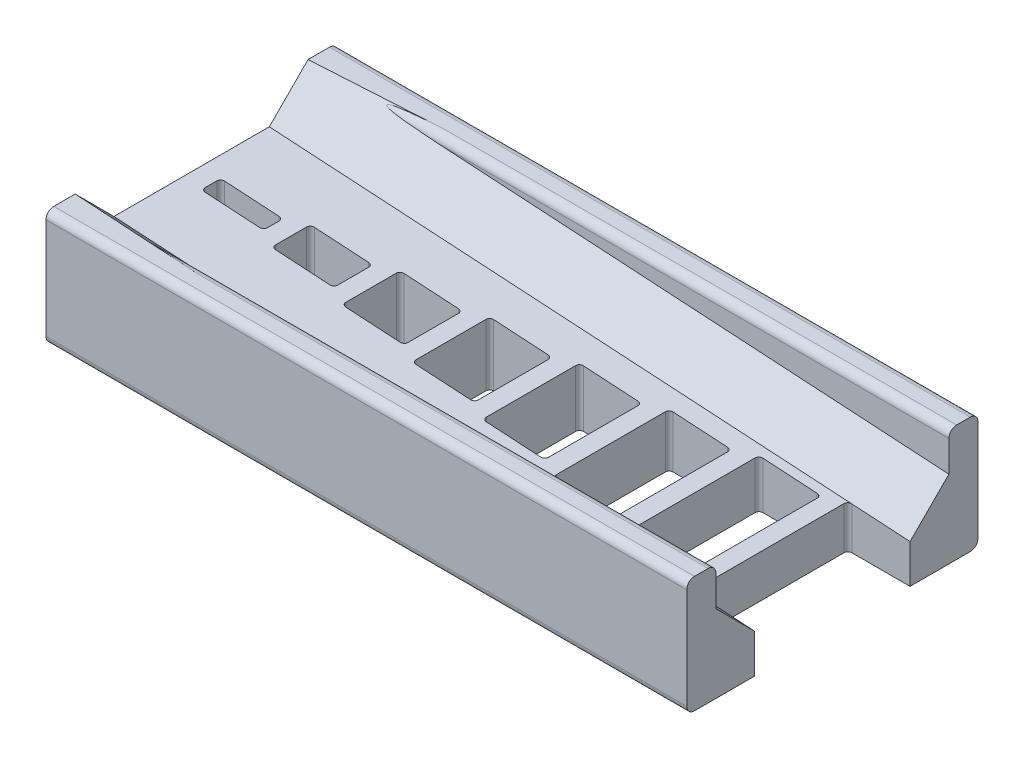
from build123d import *

# Parameters (mm, degrees)
BOSS_EXTRUDE1_DEPTH = 38.1
SKETCH2_W           = 209.55
SKETCH2_H           = 38.1
BOSS_EXTRUDE2_DEPTH = 9.525
SKETCH3_W           = 20.32
SKETCH3_H           = 6.35
SKETCH3_H_2         = 12.7
SKETCH3_H_3         = 19.05
SKETCH3_H_4         = 25.4
SKETCH3_H_5         = 31.75
SKETCH3_H_6         = 38.1
SKETCH3_H_7         = 44.45
SKETCH3_H_8         = 50.8
CUT_EXTRUDE1_DEPTH  = 123.141181515
FILLET1_R           = 1.27
CHAMFER1_SIZE       = 12.7
FILLET2_R           = 2.54


with BuildPart() as part:
    # Sketch1 → Boss-Extrude1 (new, symmetric)
    with BuildSketch(Plane.XY):
        Polygon((-105.823993484, 0), (103.726006516, 0), (103.726006516, 12.7), (-105.823993484, 25.4), align=None)
    extrude(amount=BOSS_EXTRUDE1_DEPTH, both=True)

    # Sketch2 → Boss-Extrude2 (add)
    with BuildSketch(Plane(origin=(0, 0, -38.1), x_dir=(-1, 0, 0), z_dir=(0, 0, -1))):
        with Locations((1.048993484, 19.05)):
            Rectangle(SKETCH2_W, SKETCH2_H)
    boss_extrude2 = extrude(amount=BOSS_EXTRUDE2_DEPTH)

    # Mirror1: Boss-Extrude2 across plane
    add(boss_extrude2.mirror(Plane.XY))

    # Sketch3 → Cut-Extrude1 (cut, through all)
    with BuildSketch(Plane.XZ):
        with Locations((-89.313993484, 0)):
            Rectangle(SKETCH3_W, SKETCH3_H)
        with Locations((-63.151993484, 0)):
            Rectangle(SKETCH3_W, SKETCH3_H_2)
        with Locations((-36.989993484, 0)):
            Rectangle(SKETCH3_W, SKETCH3_H_3)
        with Locations((-10.827993484, 0)):
            Rectangle(SKETCH3_W, SKETCH3_H_4)
        with Locations((15.334006516, 0)):
            Rectangle(SKETCH3_W, SKETCH3_H_5)
        with Locations((41.496006516, 0)):
            Rectangle(SKETCH3_W, SKETCH3_H_6)
        with Locations((67.658006516, 0)):
            Rectangle(SKETCH3_W, SKETCH3_H_7)
        with Locations((93.566006516, 0)):
            Rectangle(SKETCH3_W, SKETCH3_H_8)
    extrude(amount=-CUT_EXTRUDE1_DEPTH, mode=Mode.SUBTRACT)

    # Fillet1
    fillet1_edges = [part.edges().sort_by_distance(p)[0] for p in [
        (-20.987993484, 10.129212121, -12.7),
        (-20.987993484, 10.129212121, 12.7),
        (-0.667993484, 9.513454545, 12.7),
        (-0.667993484, 9.513454545, -12.7),
        (5.174006516, 9.336424242, -15.875),
        (5.174006516, 9.336424242, 15.875),
        (25.494006516, 8.720666667, 15.875),
        (25.494006516, 8.720666667, -15.875),
        (31.336006516, 8.543636364, -19.05),
        (31.336006516, 8.543636364, 19.05),
        (51.656006516, 7.927878788, 19.05),
        (51.656006516, 7.927878788, -19.05),
        (57.498006516, 7.750848485, -22.225),
        (57.498006516, 7.750848485, 22.225),
        (77.818006516, 7.135090909, 22.225),
        (77.818006516, 7.135090909, -22.225),
        (83.406006516, 6.965757576, -25.4),
        (83.406006516, 6.965757576, 25.4),
        (-99.473993484, 12.507575758, 3.175),
        (-79.153993484, 11.891818182, 3.175),
        (-79.153993484, 11.891818182, -3.175),
        (-99.473993484, 12.507575758, -3.175),
        (-73.311993484, 11.714787879, -6.35),
        (-73.311993484, 11.714787879, 6.35),
        (-52.991993484, 11.099030303, 6.35),
        (-52.991993484, 11.099030303, -6.35),
        (-47.149993484, 10.922, -9.525),
        (-47.149993484, 10.922, 9.525),
        (-26.829993484, 10.306242424, 9.525),
        (-26.829993484, 10.306242424, -9.525),
    ]]
    fillet(fillet1_edges, radius=FILLET1_R)

    # Chamfer1
    chamfer1_edges = [part.edges().sort_by_distance(p)[0] for p in [
        (-1.048993484, 19.05, 38.1),
        (-1.048993484, 19.05, -38.1),
    ]]
    chamfer(chamfer1_edges, length=CHAMFER1_SIZE - 0.0001)  # a hair under: the kernel refuses the full size

    # Fillet2
    fillet2_edges = [part.edges().sort_by_distance(p)[0] for p in [
        (-0.85757213, 38.1, -38.1),
        (-1.048993484, 0, -47.625),
        (-1.048993484, 38.1, -47.625),
        (-0.85757213, 38.1, 38.1),
        (-1.048993484, 38.1, 47.625),
        (-1.048993484, 0, 47.625),
    ]]
    fillet(fillet2_edges, radius=FILLET2_R)


solid = part.part
